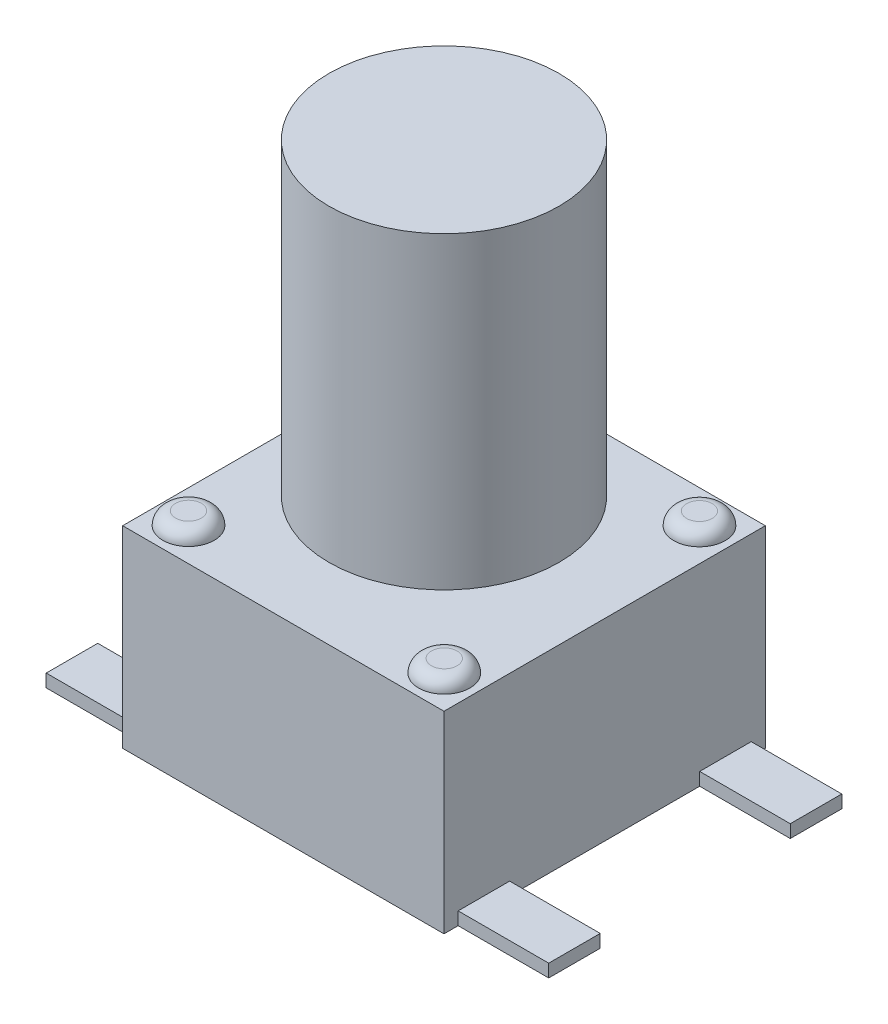
from build123d import *

# Parameters (mm, degrees)
SKETCH1_W           = 6.35
SKETCH1_H           = 6.35
BOSS_EXTRUDE1_DEPTH = 3.81
SKETCH2_W           = 1.78977558
SKETCH2_H           = 1.018153585
BOSS_EXTRUDE2_DEPTH = 0.254
SKETCH3_R           = 0.508
BOSS_EXTRUDE3_DEPTH = 0.254
FILLET1_R           = 0.254
SKETCH4_R           = 1.363047184
BOSS_EXTRUDE4_DEPTH = 0.508
SKETCH5_R           = 2.2733
BOSS_EXTRUDE5_DEPTH = 6.096


with BuildPart() as part:
    # Sketch1 → Boss-Extrude1 (new body)
    with BuildSketch(Plane(origin=(0, 0, 0), x_dir=(1, 0, 0), z_dir=(0, 1, 0))):
        Rectangle(SKETCH1_W, SKETCH1_H)
    extrude(amount=BOSS_EXTRUDE1_DEPTH)

    # Sketch2 → Boss-Extrude2 (add)
    with BuildSketch(Plane.XZ):
        with Locations((-4.06988779, -2.386523208)):
            Rectangle(SKETCH2_W, SKETCH2_H)
        with Locations((-4.06988779, 2.386523208)):
            Rectangle(SKETCH2_W, SKETCH2_H)
        with Locations((4.06988779, 2.386523208)):
            Rectangle(SKETCH2_W, SKETCH2_H)
        with Locations((4.06988779, -2.386523208)):
            Rectangle(SKETCH2_W, SKETCH2_H)
    extrude(amount=-BOSS_EXTRUDE2_DEPTH)

    # Sketch3 → Boss-Extrude3 (add)
    with BuildSketch(Plane(origin=(0, 3.81, 0), x_dir=(-1, 0, 0), z_dir=(0, 1, 0))):
        with Locations(Location((2.526830598, -2.521609873, 0), (0, 0, 270))):
            Circle(SKETCH3_R)
        with Locations(Location((-2.526830598, -2.521609873, 0), (0, 0, 270))):
            Circle(SKETCH3_R)
        with Locations(Location((-2.526830598, 2.521609873, 0), (0, 0, 270))):
            Circle(SKETCH3_R)
        with Locations(Location((2.526830598, 2.521609873, 0), (0, 0, 270))):
            Circle(SKETCH3_R)
    extrude(amount=BOSS_EXTRUDE3_DEPTH)

    # Fillet1
    fillet1_edges = [part.edges().sort_by_distance(p)[0] for p in [
        (-2.526830598, 4.064, -2.013609873),
        (2.526830598, 4.064, -2.013609873),
        (2.526830598, 4.064, 3.029609873),
        (-2.526830598, 4.064, 3.029609873),
    ]]
    fillet(fillet1_edges, radius=FILLET1_R - 0.0001)  # a hair under: the kernel refuses the full size

    # Sketch4 → Boss-Extrude4 (add)
    with BuildSketch(Plane(origin=(0, 3.81, 0), x_dir=(1, 0, 0), z_dir=(0, 1, 0))):
        with Locations(Location((0, 0, 0), (0, 0, 90))):
            Circle(SKETCH4_R)
    extrude(amount=BOSS_EXTRUDE4_DEPTH)

    # Sketch5 → Boss-Extrude5 (add)
    with BuildSketch(Plane(origin=(0, 4.318, 0), x_dir=(-1, 0, 0), z_dir=(0, 1, 0))):
        with Locations(Location((0, 0, 0), (0, 0, 270))):
            Circle(SKETCH5_R)
    extrude(amount=BOSS_EXTRUDE5_DEPTH)


solid = part.part
